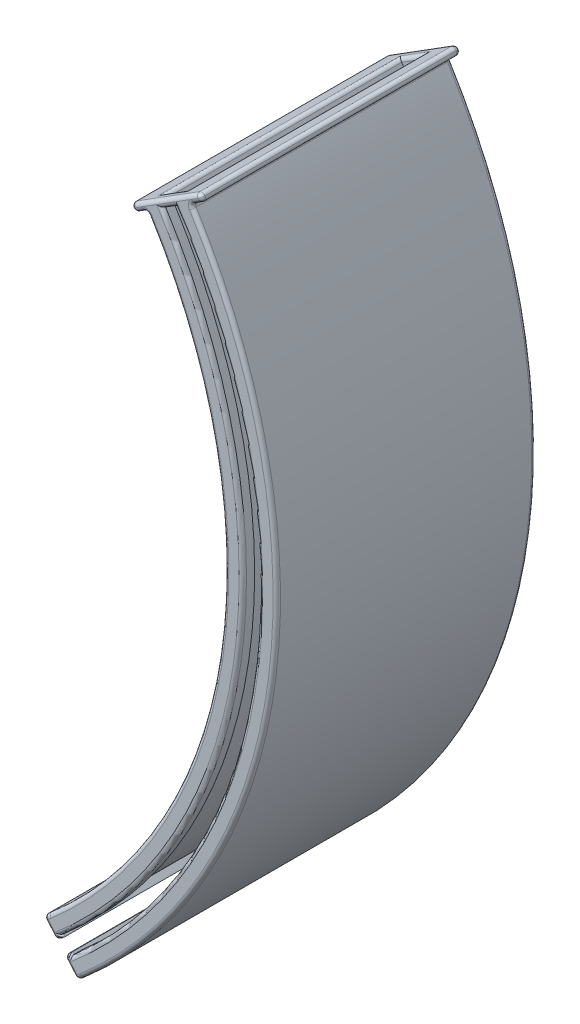
from build123d import *

# Parameters (mm, degrees)
SKETCH10_W              = 3.5
SKETCH10_H              = 17.5
SHELL1_T                = -0.8
SKETCH11_W              = 5.5
SKETCH11_H              = 17.5
SKETCH11_W_2            = 1.9
SKETCH11_H_2            = 15.9
BOSS_EXTRUDE1_DEPTH     = 0.5
SKETCH12_W              = 15.9
SKETCH12_H              = 0.55
BOSS_EXTRUDE2_DEPTH     = 0.5
CUT_EXTRUDE1_DEPTH      = 54.806515772
CUT_EXTRUDE1_DEPTH_BACK = 54.806515772
FILLET1_R               = 0.25


with BuildPart() as part:
    # Sweep1: sweep along a path in Sketch7
    with BuildLine(Plane.XY) as sweep1_path:
        ThreePointArc((11.723892809, 0.886599981), (16.638600451, -22.580062041), (5.082270205, -43.586961119))
    # Sketch10 → Sweep1 (sweep)
    with BuildSketch(Plane(origin=(0, -17.481848747, 0), x_dir=(1, 0, 0), z_dir=(0, 1, 0))):
        with Locations((18.767181512, 0)):
            Rectangle(SKETCH10_W, SKETCH10_H)
    sweep(path=sweep1_path.line)

    # Shell1
    shell1_openings = [part.faces().sort_by_distance(p)[0] for p in [
        (6.227177499, -44.910474357, 0),
        (13.205526307, 1.817869101, 0),
    ]]
    offset(amount=SHELL1_T, openings=shell1_openings, kind=Kind.INTERSECTION)

    # Sketch11 → Boss-Extrude1 (add)
    with BuildSketch(Plane(origin=(2.920606872, -4.646636383, 0), x_dir=(0.8466477136319881, 0.5321537832259836, 0), z_dir=(-0.5321537832259836, 0.8466477136319881, 0))):
        with Locations((12.147814575, 0)):
            Rectangle(SKETCH11_W, SKETCH11_H)
        with Locations((12.147814575, 0)):
            Rectangle(SKETCH11_W_2, SKETCH11_H_2, mode=Mode.SUBTRACT)
    extrude(amount=BOSS_EXTRUDE1_DEPTH)

    # Sketch12 → Boss-Extrude2 (add)
    with BuildSketch(Plane(origin=(-18.659517469, -16.141446142, 0), x_dir=(0, 0, 1), z_dir=(-0.7562932785342891, -0.654232739049229, 0))):
        Polygon((8.75, -36.289513283), (-8.75, -36.289513283), (-8.75, -37.639513283), (-7.95, -37.639513283), (-7.95, -37.089513283), (7.95, -37.089513283), (7.95, -37.639513283), (8.75, -37.639513283), align=None)
        with Locations((0, -37.364513283)):
            Rectangle(SKETCH12_W, SKETCH12_H)
        with Locations((0, -38.714513283)):
            Rectangle(SKETCH12_W, SKETCH12_H)
        Polygon((-7.95, -38.439513283), (-8.75, -38.439513283), (-8.75, -39.789513283), (8.75, -39.789513283), (8.75, -38.439513283), (7.95, -38.439513283), (7.95, -38.989513283), (-7.95, -38.989513283), align=None)
    extrude(amount=BOSS_EXTRUDE2_DEPTH)

    # Sketch13 → Cut-Extrude1 (cut, two sides: drawn at the far end of the back side and taken through both)
    with BuildSketch(Plane.XY.offset(8.75).offset(-CUT_EXTRUDE1_DEPTH_BACK)):
        with BuildLine():
            Line((13.67118255, 2.110553682), (12.739870065, 1.525184521))
            ThreePointArc((12.739870065, 1.525184521), (17.825438969, -22.75730293), (5.867349492, -44.494513054))
            Line((5.867349492, -44.494513054), (6.587005505, -45.32643566))
            ThreePointArc((6.587005505, -45.32643566), (18.913374277, -22.919773746), (13.67118255, 2.110553682))
        make_face()
    extrude(amount=CUT_EXTRUDE1_DEPTH + CUT_EXTRUDE1_DEPTH_BACK, mode=Mode.SUBTRACT)

    # Fillet1
    fillet1_edges = [part.edges().sort_by_distance(p)[0] for p in [
        (15.110483663, 3.015215114, -8.75),
        (15.400769074, 3.492953934, -8.75),
        (12.939449416, 2.241192958, -8.75),
        (10.744206649, 0.566108126, -8.75),
        (11.300568952, 0.620523089, -8.75),
        (16.638600451, -22.580062041, -8.75),
        (4.893196886, -43.750519304, -8.75),
        (5.145730665, -44.424575452, -8.75),
        (5.776411083, -44.77151523, -8.75),
        (5.916416947, -44.551235049, -8.75),
        (17.825438969, -22.75730293, -8.75),
        (13.205526307, 1.817869101, -8.75),
        (18.913374277, -22.919773746, -8.75),
        (6.53793805, -45.269713664, -8.75),
        (6.299797275, -45.376549853, -8.75),
        (6.552331054, -46.050606001, -8.75),
        (7.183011472, -46.397545779, -8.75),
        (20.100212795, -23.097014635, -8.75),
        (20.100212795, -23.097014635, 8.75),
        (14.687159806, 2.749138222, 0),
        (11.300568952, 0.620523089, 8.75),
        (10.744206649, 0.566108126, 8.75),
        (12.939449416, 2.241192958, 8.75),
        (15.400769074, 3.492953934, 8.75),
        (15.110483663, 3.015215114, 8.75),
        (7.183011472, -46.397545779, 8.75),
        (6.552331054, -46.050606001, 8.75),
        (6.299797275, -45.376549853, 8.75),
        (6.53793805, -45.269713664, 8.75),
        (18.913374277, -22.919773746, 8.75),
        (13.205526307, 1.817869101, 8.75),
        (17.825438969, -22.75730293, 8.75),
        (5.916416947, -44.551235049, 8.75),
        (5.776411083, -44.77151523, 8.75),
        (5.145730665, -44.424575452, 8.75),
        (4.893196886, -43.750519304, 8.75),
        (16.638600451, -22.580062041, 8.75),
        (12.939449416, 2.241192958, 7.95),
        (13.743764744, 2.746739052, 0),
        (12.939449416, 2.241192958, -7.95),
        (12.135134088, 1.735646864, 0),
        (6.993938153, -46.561103964, 0),
        (6.110723955, -45.540108038, 0),
        (5.587337764, -44.935073415, 0),
        (4.704123566, -43.914077489, 0),
        (11.723892809, 0.886599981, 0),
        (10.877245095, 0.354446198, 0),
        (10.611168203, 0.777770054, 0),
        (15.267730628, 3.704615862, 0),
        (15.53380752, 3.281292005, 0),
    ]]
    fillet(fillet1_edges, radius=FILLET1_R - 0.0001)  # a hair under: the kernel refuses the full size


solid = part.part
